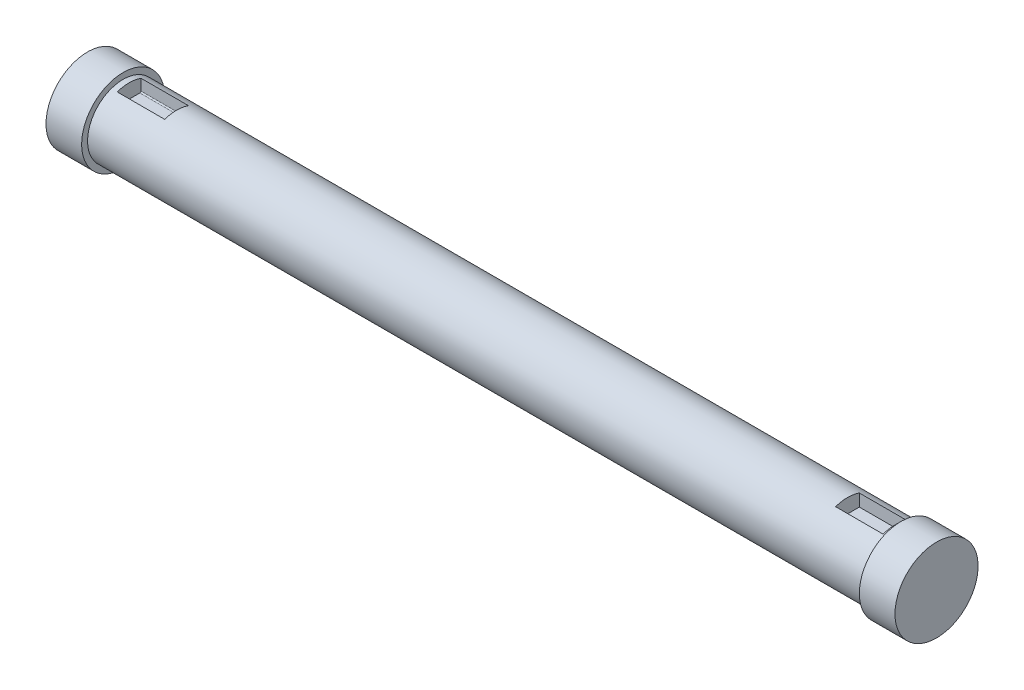
from build123d import *
from build123d.topology import SkipClean

# Parameters (mm, degrees)
SKETCH_2_R          = 3
EXTRUDE_1_DEPTH     = 4
EXTRUDE_2_DEPTH     = 2.5
SKETCH_5_R          = 2.5
EXTRUDE_3_DEPTH     = 9
MIRROR_START        = 15.5
MIRROR_1_DEPTH      = 0.381197772
MIRROR_START_2      = 15.881197772
MIRROR_1_2_DEPTH    = 4.618802228
EXTRUDE_4_DEPTH     = 5
SKETCH_10_R         = 2.5
EXTRUDE_5_DEPTH     = 6
SKETCH_11_R         = 3
EXTRUDE_6_DEPTH     = 5.5
EXTRUDE_START       = 10
SKETCH_12_R         = 3
EXTRUDE_8_DEPTH     = 10
SKETCH_13_R         = 3
EXTRUDE_9_DEPTH     = 10
SKETCH_14_OUTSIDE_W = 32.048
SKETCH_14_OUTSIDE_H = 35.048
SKETCH_14_OUTSIDE_R = 3
CUT_EXTRUDE_2_DEPTH = 59.352377883
SKETCH_15_R         = 3
EXTRUDE_10_DEPTH    = 29.5
EXTRUDE_11_DEPTH    = 26.5
CUT_EXTRUDE_START   = -3.5
SKETCH_17_W         = 2
SKETCH_17_H         = 1.2
CUT_EXTRUDE_3_DEPTH = 4
FILLET_1_R          = 0.1
SKETCH_18_R         = 3.5
EXTRUDE_12_DEPTH    = 3


with BuildPart() as part:
    # 草图2 → 凸台-拉伸1 (new, symmetric)
    with BuildSketch(Plane(origin=(0, 0, 0), x_dir=(0, 0, -1), z_dir=(1, 0, 0))):
        Circle(SKETCH_2_R)
    extrude_1 = extrude(amount=EXTRUDE_1_DEPTH, both=True)

    # 草图3 → 凸台-拉伸2 (add, symmetric)
    with BuildSketch(Plane(origin=(4, 0, 0), x_dir=(0, 0, -1), z_dir=(1, 0, 0))):
        with BuildLine():
            Line((5, 0), (5, -8))
            ThreePointArc((5, -8), (0, -13), (-5, -8))
            Line((-5, -8), (-5, 0))
            ThreePointArc((-5, 0), (0, 5), (5, 0))
        make_face()
    extrude(amount=EXTRUDE_2_DEPTH, both=True)

    # 切除-旋转1: read off the stored shape, not the designer's step
    # 切除-旋转1 outline → 切除-旋转1 (revolve, cut)
    with BuildSketch(Plane.YX):
        Polygon((13.0002322, 6.118936215), (4.99999958, 1.499999757), (13.0002322, 1.499999757), align=None)
    revolve(axis=Axis((0, 0, 0), (1, 0, 0)), mode=Mode.SUBTRACT)

    # 草图5 → 凸台-拉伸3 (add)
    with BuildSketch(Plane(origin=(6.5, 0, 0), x_dir=(0, 0, -1), z_dir=(1, 0, 0))):
        with Locations((0, -8)):
            Circle(SKETCH_5_R)
    extrude(amount=EXTRUDE_3_DEPTH)

    # 镜向1: read off the stored shape, not the designer's step
    # 镜向1 outline → 镜向1 (add)
    with BuildSketch(Plane.YZ.offset(MIRROR_START)):
        with BuildLine():
            Line((-8, -5), (0, -5))
            ThreePointArc((0, -5), (5, 0), (0, 5))
            Line((0, 5), (-7.999999997, 5))
            ThreePointArc((-7.999999997, 5), (-13, 2e-09), (-8, -5))
        make_face()
    extrude(amount=MIRROR_1_DEPTH)

    # Mirror 1 2 outline → Mirror 1 2 (add)
    with BuildSketch(Plane.YZ.offset(MIRROR_START_2)):
        with BuildLine():
            Line((-8, -5), (0, -5))
            ThreePointArc((0, -5), (5, 0), (0, 5))
            Line((0, 5), (-7.999999997, 5))
            ThreePointArc((-7.999999997, 5), (-13, 2e-09), (-8, -5))
        make_face()
    extrude(amount=MIRROR_1_2_DEPTH)

    # Mirror 1 3 outline → Mirror 1 3 (revolve, cut)
    with BuildSketch(Plane.YX):
        Polygon((13.0002322, 20.500000243), (4.99999958, 20.500000243), (13.0002322, 15.881063785), align=None)
    revolve(axis=Axis((0, 0, 0), (1, 0, 0)), mode=Mode.SUBTRACT)

    # 镜向2: 凸台-拉伸1 across plane
    add(extrude_1.mirror(Plane(origin=(11, 0, 0), x_dir=(0, 0, 1), z_dir=(1, 0, 0))))

    # 草图6 → 凸台-拉伸4 (add)
    with BuildSketch(Plane(origin=(26, 0, 0), x_dir=(0, 0, -1), z_dir=(1, 0, 0))):
        with BuildLine():
            Line((0, -5), (-5, -5))
            ThreePointArc((-5, -5), (-10, 0), (-5, 5))
            Line((-5, 5), (0, 5))
            ThreePointArc((0, 5), (5, 0), (0, -5))
        make_face()
    extrude_4 = extrude(amount=EXTRUDE_4_DEPTH)

    # 切除-旋转2: read off the stored shape, not the designer's step
    # 切除-旋转2 outline → 切除-旋转2 (revolve, cut)
    with BuildSketch(Plane.YX):
        Polygon((10.000264544, 30.195720135), (5, 26), (10.000264544, 26), align=None)
    cut_revolve_2 = revolve(axis=Axis((0, 0, 0), (1, 0, 0)), mode=Mode.SUBTRACT)

    # 草图10 → 凸台-拉伸5 (add)
    with BuildSketch(Plane(origin=(31, 0, 0), x_dir=(0, 0, -1), z_dir=(1, 0, 0))):
        with Locations((-5, 0)):
            Circle(SKETCH_10_R)
    extrude(amount=EXTRUDE_5_DEPTH)

    # 镜向3: 凸台-拉伸4, 切除-旋转2 across plane
    add(extrude_4.mirror(Plane(origin=(34, 0, 0), x_dir=(0, 0, 1), z_dir=(1, 0, 0))))
    add(cut_revolve_2.mirror(Plane(origin=(34, 0, 0), x_dir=(0, 0, 1), z_dir=(1, 0, 0))), mode=Mode.SUBTRACT)

    # 草图11 → 凸台-拉伸6 (add)
    with BuildSketch(Plane(origin=(42, 0, 0), x_dir=(0, 0, -1), z_dir=(1, 0, 0))):
        Circle(SKETCH_11_R)
    extrude(amount=EXTRUDE_6_DEPTH)

    # 草图12 → 凸台-拉伸8 (add)
    with BuildSketch(Plane.ZY.offset(4).offset(EXTRUDE_START)):
        Circle(SKETCH_12_R)
    extrude(amount=-EXTRUDE_8_DEPTH)

    # 草图13 → 凸台-拉伸9 (add)
    with BuildSketch(Plane(origin=(47.5, 0, 0), x_dir=(0, 0, -1), z_dir=(1, 0, 0))):
        with Locations(Location((0, 0, 0), (0, 0, 180))):
            Circle(SKETCH_13_R)
    extrude(amount=EXTRUDE_9_DEPTH)

    # 草图14 outside → 切除-拉伸2 (cut, through all)
    with SkipClean():  # the faces are left unmerged after this step: merging them gives an invalid solid
        with BuildSketch(Plane.ZY.offset(-1.5)):
            with Locations((2.5, -4)):
                Rectangle(SKETCH_14_OUTSIDE_W, SKETCH_14_OUTSIDE_H)
            Circle(SKETCH_14_OUTSIDE_R, mode=Mode.SUBTRACT)
        extrude(amount=-CUT_EXTRUDE_2_DEPTH, mode=Mode.SUBTRACT)


with BuildPart() as cut_extrude_2_piece_1:
    # of the separate pieces the step leaves, piece 1, a body of its own (cut_extrude_2_pieces)
    add(part.part.solids().sort_by_distance((37, -1.139901312, 2.775))[0])



with BuildPart() as cut_extrude_2_piece_2:
    # of the separate pieces the step leaves, piece 2, a body of its own (cut_extrude_2_pieces)
    add(part.part.solids().sort_by_distance((6.5, 0, 3))[0])


with BuildPart() as cut_extrude_2_piece_1_1:
    with SkipClean():  # the faces are left unmerged after this step: merging them gives an invalid solid
        add(cut_extrude_2_piece_1.part)

        add(cut_extrude_2_piece_2.part)  # 凸台-拉伸10 merges 切除-拉伸2 piece 2
        # 草图15 → 凸台-拉伸10 (add)
        with BuildSketch(Plane.ZY.offset(-15.5)):
            Circle(SKETCH_15_R)
        extrude(amount=EXTRUDE_10_DEPTH)

    # 草图16 → 凸台-拉伸11 (add)
    with BuildSketch(Plane(origin=(31, 0, 0), x_dir=(0, 0, -1), z_dir=(1, 0, 0))):
        with BuildLine():
            ThreePointArc((-2.775, -1.139901312), (-2.5, 0), (-2.775, 1.139901312))
            ThreePointArc((-2.775, 1.139901312), (3, 0), (-2.775, -1.139901312))
        make_face()
    extrude(amount=EXTRUDE_11_DEPTH)

    # 草图17 → 切除-拉伸3 (cut)
    with SkipClean():  # the faces are left unmerged after this step: merging them gives an invalid solid
        with BuildSketch(Plane.ZY.offset(14).offset(CUT_EXTRUDE_START)):
            with Locations((0, 2.4)):
                Rectangle(SKETCH_17_W, SKETCH_17_H)
        cut_extrude_3 = extrude(amount=-CUT_EXTRUDE_3_DEPTH, mode=Mode.SUBTRACT)

    # 圆角1
    fillet_1_edges = [cut_extrude_2_piece_1_1.edges().sort_by_distance(p)[0] for p in [
        (-8.5, 1.8, 1),
        (-8.5, 1.8, -1),
    ]]
    fillet(fillet_1_edges, radius=FILLET_1_R)

    # 镜向4: 切除-拉伸3 across plane
    with SkipClean():  # the faces are left unmerged after this step: merging them gives an invalid solid
        add(cut_extrude_3.mirror(Plane.ZY.offset(-21.75)), mode=Mode.SUBTRACT)

    # 草图18 → 凸台-拉伸12 (add)
    with SkipClean():  # the faces are left unmerged after this step: merging them gives an invalid solid
        with BuildSketch(Plane.ZY.offset(14)):
            Circle(SKETCH_18_R)
        extrude_12 = extrude(amount=-EXTRUDE_12_DEPTH)

    # 镜向5: 凸台-拉伸12 across plane
    with SkipClean():  # the faces are left unmerged after this step: merging them gives an invalid solid
        add(extrude_12.mirror(Plane.ZY.offset(-21.75)))


solid = cut_extrude_2_piece_1_1.part
